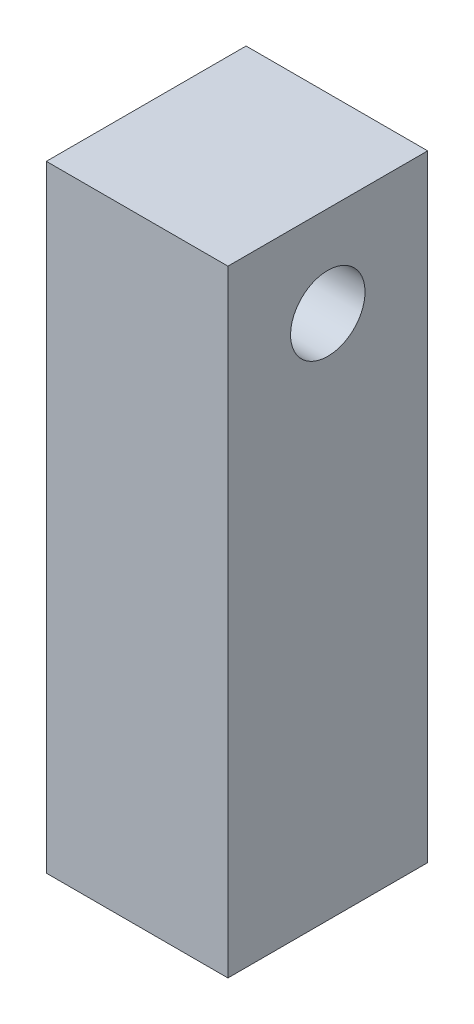
from build123d import *

# Parameters (mm, degrees)
SKETCH1_W               = 50
SKETCH1_H               = 150
BOSS_EXTRUDE1_DEPTH     = 55
CUT_EXTRUDE1_DEPTH      = 168.406690428
CUT_EXTRUDE1_DEPTH_BACK = 45
SKETCH2_R               = 10.25
SKETCH7_R               = 1
SKETCH7_R_2             = 4.25
CUT_EXTRUDE3_DEPTH      = 10
SKETCH8_W               = 55
SKETCH8_H               = 55
SKETCH8_R               = 10.25
BOSS_EXTRUDE2_DEPTH     = 50
CUT_EXTRUDE4_DEPTH      = 214.717102732
SKETCH11_W              = 34
SKETCH11_H              = 13.25
BOSS_EXTRUDE4_DEPTH     = 25


with BuildPart() as part:
    # Sketch1 → Boss-Extrude1 (new body)
    with BuildSketch(Plane.XY):
        with Locations((0, -75)):
            Rectangle(SKETCH1_W, SKETCH1_H)
    extrude(amount=-BOSS_EXTRUDE1_DEPTH)

    # Sketch2 → Cut-Extrude1 (cut, two sides: drawn at the far end of the back side and taken through both)
    with BuildSketch(Plane(origin=(25, 0, 0), x_dir=(0, 0, -1), z_dir=(1, 0, 0)).offset(-CUT_EXTRUDE1_DEPTH_BACK)):
        with Locations((27.5, -25)):
            Circle(SKETCH2_R)
    extrude(amount=CUT_EXTRUDE1_DEPTH + CUT_EXTRUDE1_DEPTH_BACK, mode=Mode.SUBTRACT)

    # Sketch7 → Cut-Extrude3 (cut)
    with BuildSketch(Plane(origin=(-20, 0, 0), x_dir=(0, 0, -1), z_dir=(1, 0, 0))):
        with Locations((27.5, -17)):
            Circle(SKETCH7_R)
        with Locations((27.5, -25)):
            Circle(SKETCH7_R_2)
        with Locations((35.5, -25)):
            Circle(SKETCH7_R)
        with Locations((19.5, -25)):
            Circle(SKETCH7_R)
        with Locations((27.5, -33)):
            Circle(SKETCH7_R)
    extrude(amount=-CUT_EXTRUDE3_DEPTH, mode=Mode.SUBTRACT)

    # Sketch8 → Boss-Extrude2 (add)
    with BuildSketch(Plane(origin=(25, 0, 0), x_dir=(0, 0, -1), z_dir=(1, 0, 0))):
        with Locations((27.5, -177.5)):
            Rectangle(SKETCH8_W, SKETCH8_H)
        with Locations((27.5, -180)):
            Circle(SKETCH8_R, mode=Mode.SUBTRACT)
    extrude(amount=-BOSS_EXTRUDE2_DEPTH)

    # Sketch10 → Cut-Extrude4 (cut, through all)
    with BuildSketch(Plane.XY):
        Polygon((25, -205), (25, -169.75), (17, -169.75), (17, -144.75), (-17, -144.75), (-17, -169.75), (-25, -169.75), (-25, -205), align=None)
    extrude(amount=-CUT_EXTRUDE4_DEPTH, mode=Mode.SUBTRACT)

    # Sketch11 → Boss-Extrude4 (add)
    with BuildSketch(Plane.XZ.offset(144.75)):
        with Locations((0, -6.625)):
            Rectangle(SKETCH11_W, SKETCH11_H)
        with Locations((0, -48.375)):
            Rectangle(SKETCH11_W, SKETCH11_H)
    extrude(amount=BOSS_EXTRUDE4_DEPTH)


solid = part.part
